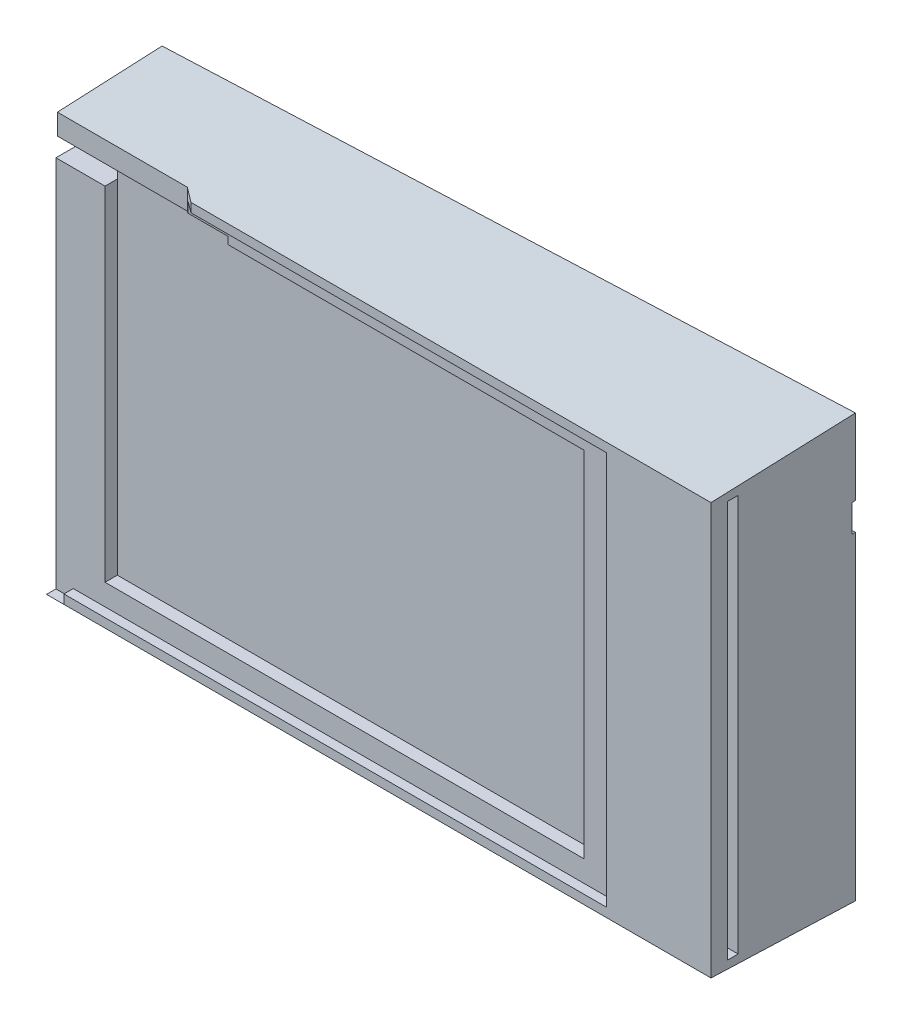
from build123d import *

# Parameters (mm, degrees)
FILM_PLANE_DEPTH        = 3
CUT_EXTRUDE2_DEPTH      = 1.3
NOTCH_W                 = 6.8
NOTCH_H                 = 2.5
NOTCH_CUT_DEPTH         = 4.1
SKETCH10_W              = 6.297854397
SKETCH10_H              = 3.8
CUT_EXTRUDE4_DEPTH      = 0.5
CUT_EXTRUDE5_DEPTH      = 1.5
CUT_EXTRUDE6_DEPTH      = 111.449366381
CUT_EXTRUDE6_DEPTH_BACK = 5
SKETCH_1_W              = 1.5
SKETCH_1_H              = 55
OUTLET_DEPTH            = 2


with BuildPart() as part:
    # Sketch3 → body section 0
    with BuildSketch(Plane(origin=(0, 0, 0), x_dir=(0, 0, -1), z_dir=(1, 0, 0))):
        with BuildLine():
            Line((0, 61), (16, 61.75))
            Line((16, 61.75), (16, 3.25))
            Line((16, 3.25), (0, 4))
            Line((0, 4), (0, 61))
        make_face()
    # Sketch2 → body section 1
    with BuildSketch(Plane(origin=(92, 0, 0), x_dir=(0, 0, -1), z_dir=(1, 0, 0))):
        with BuildLine():
            Line((0, 61), (20, 61.75))
            Line((20, 61.75), (20, 3.25))
            Line((20, 3.25), (0, 4))
            Line((0, 4), (0, 61))
        make_face()
    loft()

    # Sketch6 → film plane (cut)
    with BuildSketch(Plane.XY):
        Polygon((6.8, 58.2), (6.8, 8.2), (73.1, 8.2), (73.1, 57.2), (23.8, 57.2), (23.8, 58.2), align=None)
    extrude(amount=-FILM_PLANE_DEPTH, mode=Mode.SUBTRACT)

    # Sketch7 → Cut-Extrude2 (cut)
    with BuildSketch(Plane.XY):
        Polygon((77.5, 5.25), (77.5, 59.75), (0, 59.75), (0, 4), (2.4, 4), (2.4, 5.25), align=None)
    extrude(amount=-CUT_EXTRUDE2_DEPTH, mode=Mode.SUBTRACT)

    # notch → notch-cut (cut)
    with BuildSketch(Plane.XY.offset(-1.3)):
        with Locations((3.4, 56.95)):
            Rectangle(NOTCH_W, NOTCH_H)
    extrude(amount=-NOTCH_CUT_DEPTH, mode=Mode.SUBTRACT)

    # Sketch10 → Cut-Extrude4 (cut)
    with BuildSketch(Plane(origin=(-0.694339623, 0, -15.969811321), x_dir=(-0.9990561583550596, 0, 0.04343722427630701), z_dir=(-0.043437224276307015, 0, -0.9990561583550597))):
        with Locations((-89.632983856, 49.35)):
            Rectangle(SKETCH10_W, SKETCH10_H)
    extrude(amount=-CUT_EXTRUDE4_DEPTH, mode=Mode.SUBTRACT)

    # Sketch11 → Cut-Extrude5 (cut)
    with BuildSketch(Plane(origin=(-0.694339623, 0, -15.969811321), x_dir=(-0.9990561583550596, 0, 0.04343722427630701), z_dir=(-0.043437224276307015, 0, -0.9990561583550597))):
        with BuildLine():
            Line((-72.5, 14.5), (-64, 14.5))
            ThreePointArc((-64, 14.5), (-62.232233047, 15.232233047), (-61.5, 17))
            Line((-61.5, 17), (-61.5, 48))
            ThreePointArc((-61.5, 48), (-62.232233047, 49.767766953), (-64, 50.5))
            Line((-64, 50.5), (-72.5, 50.5))
            ThreePointArc((-72.5, 50.5), (-74.267766953, 49.767766953), (-75, 48))
            Line((-75, 48), (-75, 17))
            ThreePointArc((-75, 17), (-74.267766953, 15.232233047), (-72.5, 14.5))
        make_face()
        with BuildLine():
            Line((-24.5, 14.5), (-16, 14.5))
            ThreePointArc((-16, 14.5), (-14.232233047, 15.232233047), (-13.5, 17))
            Line((-13.5, 17), (-13.5, 48))
            ThreePointArc((-13.5, 48), (-14.232233047, 49.767766953), (-16, 50.5))
            Line((-16, 50.5), (-24.5, 50.5))
            ThreePointArc((-24.5, 50.5), (-26.267766953, 49.767766953), (-27, 48))
            Line((-27, 48), (-27, 17))
            ThreePointArc((-27, 17), (-26.267766953, 15.232233047), (-24.5, 14.5))
        make_face()
    extrude(amount=-CUT_EXTRUDE5_DEPTH, mode=Mode.SUBTRACT)

    # Sketch5 → Cut-Extrude6 (cut, two sides: drawn at the far end of the back side and taken through both)
    with BuildSketch(Plane(origin=(0, 61, 0), x_dir=(1, 0, 0), z_dir=(0, 1, 0)).offset(-CUT_EXTRUDE6_DEPTH_BACK)):
        Polygon((0, 1.5), (18, 1.5), (20, 0), (0, 0), align=None)
    extrude(amount=CUT_EXTRUDE6_DEPTH + CUT_EXTRUDE6_DEPTH_BACK, mode=Mode.SUBTRACT)

    # 草图1 → outlet (cut)
    with BuildSketch(Plane(origin=(92, 0, 0), x_dir=(0, 0, -1), z_dir=(1, 0, 0))):
        with Locations((3, 32.5)):
            Rectangle(SKETCH_1_W, SKETCH_1_H)
    extrude(amount=-OUTLET_DEPTH, mode=Mode.SUBTRACT)


solid = part.part
